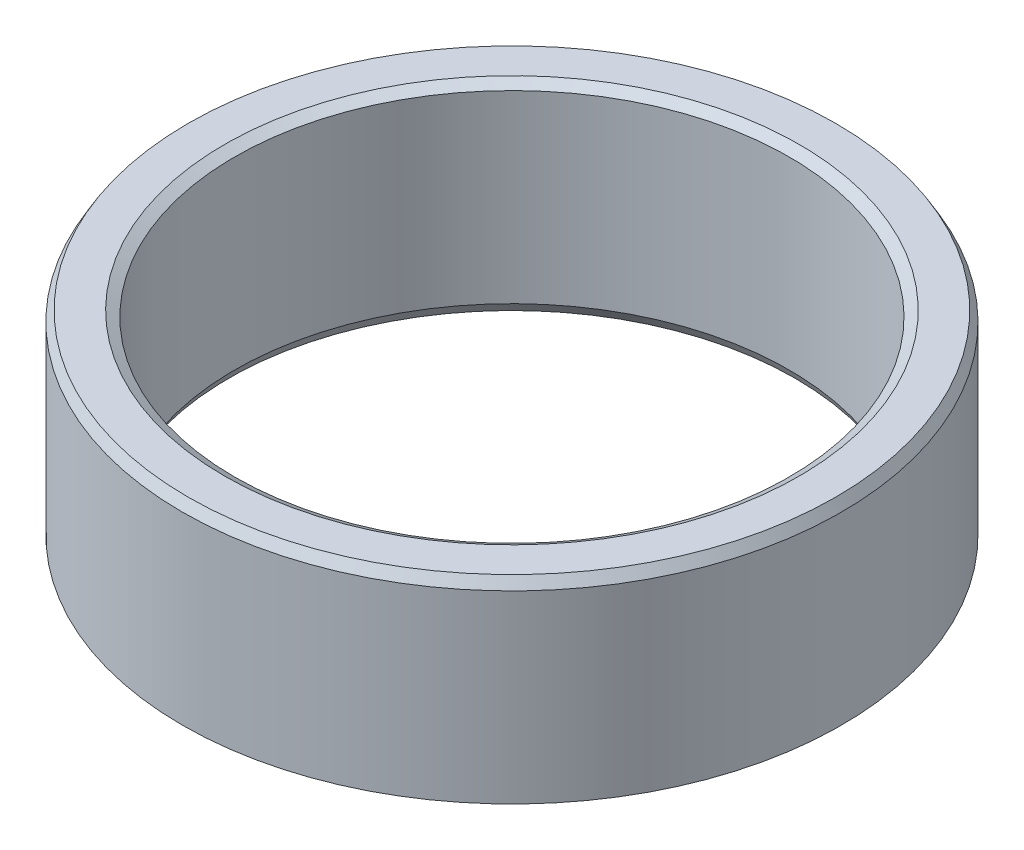
from build123d import *
from OCP.BRepFilletAPI import BRepFilletAPI_MakeChamfer

# Parameters (mm, degrees)
SKETCH1_R           = 32.5
BOSS_EXTRUDE1_DEPTH = 19.761511298
SKETCH2_R           = 27.342161366
CUT_EXTRUDE1_DEPTH  = 51.030164189
CHAMFER1_SIZE       = 0.990921832
CHAMFER1_SIZE2      = 0.572108986


with BuildPart() as part:
    # Sketch1 → Boss-Extrude1 (new body)
    with BuildSketch(Plane(origin=(0, 0, 0), x_dir=(1, 0, 0), z_dir=(0, 1, 0))):
        Circle(SKETCH1_R)
    extrude(amount=BOSS_EXTRUDE1_DEPTH)

    # Sketch2 → Cut-Extrude1 (cut, through all)
    with BuildSketch(Plane(origin=(0, 0, 0), x_dir=(1, 0, 0), z_dir=(0, 1, 0))):
        Circle(SKETCH2_R)
    extrude(amount=CUT_EXTRUDE1_DEPTH, mode=Mode.SUBTRACT)

    # Chamfer1: one chamfer whose edges measure the first distance from different faces: ONE call of the kernel's chamfer builder (chamfer() names one face for all edges)
    chamfer1_edges_1 = [part.edges().sort_by_distance(p)[0] for p in [
        (-27.342161366, 19.761511298, 0),
    ]]
    chamfer1_side_1 = [part.faces().sort_by_distance(p)[0] for p in [
        (-31.580761184, 19.761511298, 0),
    ]]
    chamfer1_edges_2 = [part.edges().sort_by_distance(p)[0] for p in [
        (-27.342161366, 0, 0),
    ]]
    chamfer1_side_2 = [part.faces().sort_by_distance(p)[0] for p in [
        (-27.342161366, 9.880755649, 0),
    ]]
    chamfer1_edges_3 = [part.edges().sort_by_distance(p)[0] for p in [
        (-32.5, 0, 0),
    ]]
    chamfer1_side_3 = [part.faces().sort_by_distance(p)[0] for p in [
        (-31.580761184, 0, 0),
    ]]
    chamfer1_edges_4 = [part.edges().sort_by_distance(p)[0] for p in [
        (-32.5, 19.761511298, 0),
    ]]
    chamfer1_side_4 = [part.faces().sort_by_distance(p)[0] for p in [
        (-32.5, 9.880755649, 0),
    ]]
    chamfer1 = BRepFilletAPI_MakeChamfer(part.part.solid().wrapped)
    for e in chamfer1_edges_1:
        chamfer1.Add(CHAMFER1_SIZE, CHAMFER1_SIZE2, e.wrapped, chamfer1_side_1[0].wrapped)  # the first distance lies on this face
    for e in chamfer1_edges_2:
        chamfer1.Add(CHAMFER1_SIZE, CHAMFER1_SIZE2, e.wrapped, chamfer1_side_2[0].wrapped)  # the first distance lies on this face
    for e in chamfer1_edges_3:
        chamfer1.Add(CHAMFER1_SIZE, CHAMFER1_SIZE2, e.wrapped, chamfer1_side_3[0].wrapped)  # the first distance lies on this face
    for e in chamfer1_edges_4:
        chamfer1.Add(CHAMFER1_SIZE, CHAMFER1_SIZE2, e.wrapped, chamfer1_side_4[0].wrapped)  # the first distance lies on this face
    add(Compound.cast(chamfer1.Shape()), mode=Mode.REPLACE)


solid = part.part
